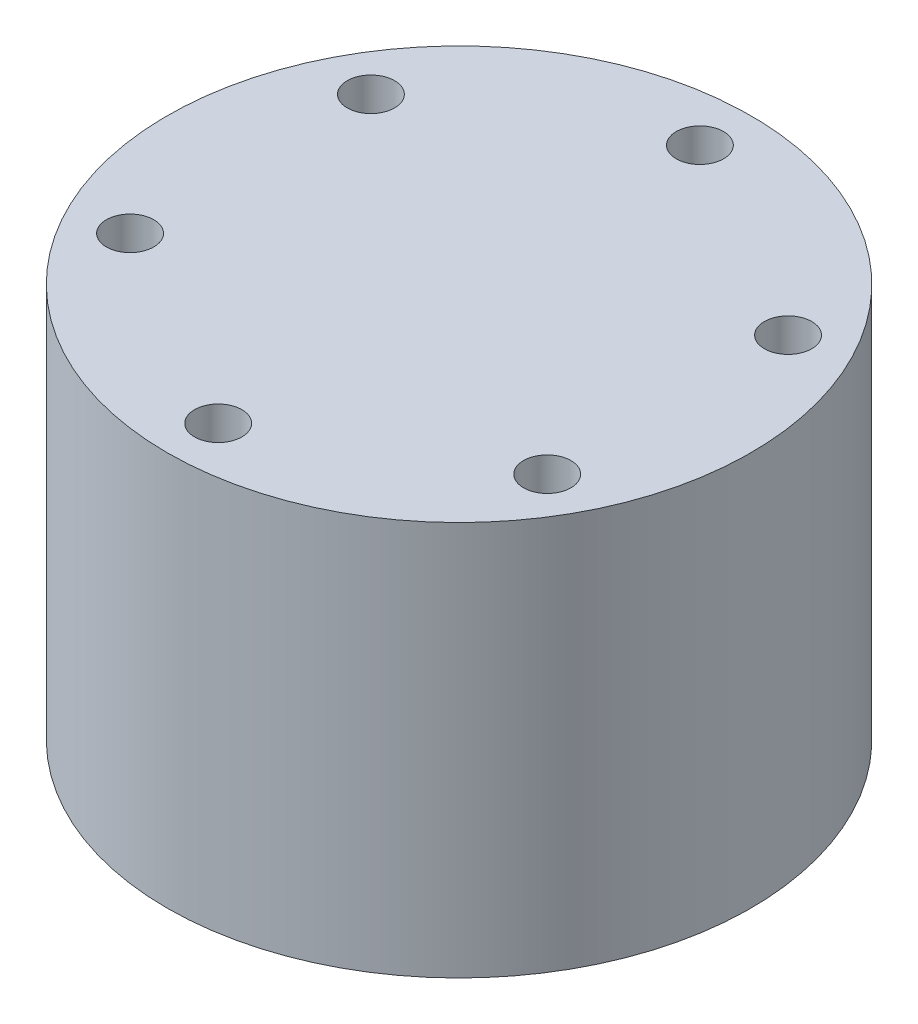
from build123d import *

# Parameters (mm, degrees)
SKETCH1_R           = 18.5
BOSS_EXTRUDE1_DEPTH = 25
SKETCH2_R           = 1.5
CUT_EXTRUDE1_DEPTH  = 10


with BuildPart() as part:
    # Sketch1 → Boss-Extrude1 (new body)
    with BuildSketch(Plane(origin=(0, 0, 0), x_dir=(1, 0, 0), z_dir=(0, 1, 0))):
        Circle(SKETCH1_R)
    extrude(amount=BOSS_EXTRUDE1_DEPTH)

    # Sketch2 → Cut-Extrude1 (cut)
    with BuildSketch(Plane(origin=(0, 25, 0), x_dir=(1, 0, 0), z_dir=(0, 1, 0))):
        with Locations((13.219877789, 7.6325)):
            Circle(SKETCH2_R)
        with Locations((13.219877789, -7.6325)):
            Circle(SKETCH2_R)
        with Locations((0, 15.265)):
            Circle(SKETCH2_R)
        with Locations((0, -15.265)):
            Circle(SKETCH2_R)
        with Locations((-13.219877789, 7.6325)):
            Circle(SKETCH2_R)
        with Locations((-13.219877789, -7.6325)):
            Circle(SKETCH2_R)
    extrude(amount=-CUT_EXTRUDE1_DEPTH, mode=Mode.SUBTRACT)


solid = part.part
